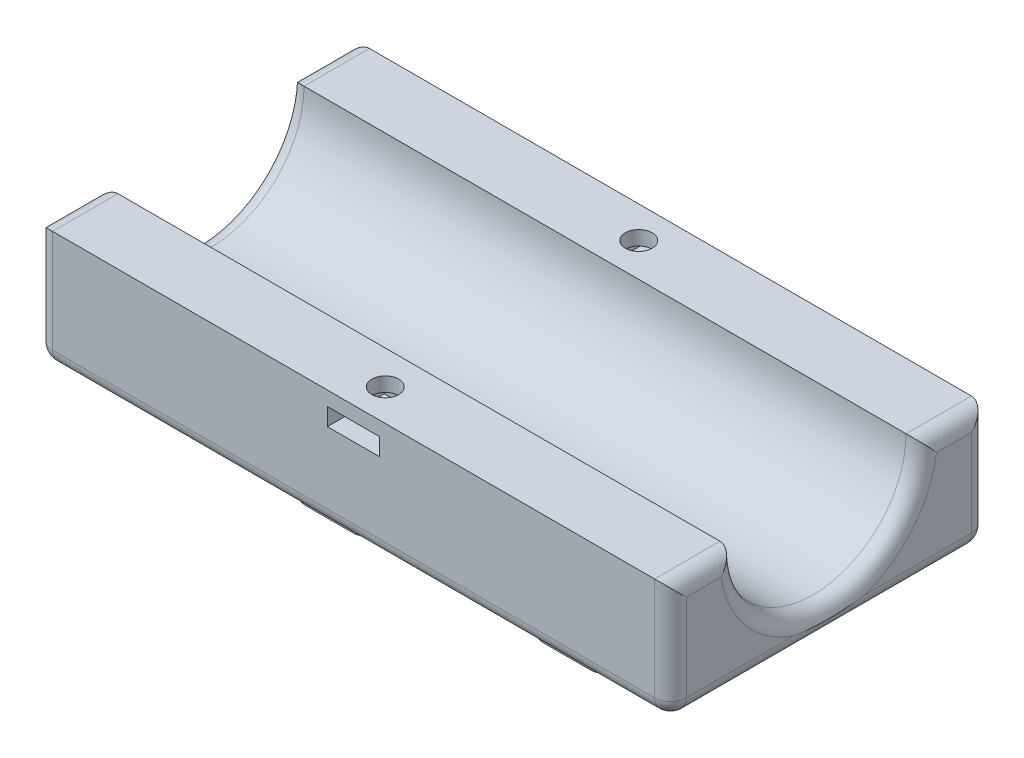
from build123d import *

# Parameters (mm, degrees)
BOSS_EXTRUDE2_DEPTH   = 101.6
SKETCH14_W            = 12.7
SKETCH14_H            = 13.97
BOSS_EXTRUDE3_DEPTH   = 20.32
F_6_CLEARANCE_HOLE1_D = 4.3053
SKETCH8_W             = 8.382
SKETCH8_H             = 9.144
CUT_EXTRUDE2_DEPTH    = 2.794
FILLET1_R             = 2.54


with BuildPart() as part:
    # Sketch3 → Boss-Extrude2 (new body)
    with BuildSketch(Plane(origin=(0, 0, 0), x_dir=(0, 0, -1), z_dir=(1, 0, 0))):
        with BuildLine():
            Line((40.3225, 19.05), (50.8, 19.05))
            Line((50.8, 19.05), (50.8, 0))
            Line((50.8, 0), (0, 0))
            Line((0, 0), (0, 19.05))
            Line((0, 19.05), (10.4775, 19.05))
            ThreePointArc((10.4775, 19.05), (25.4, 4.1275), (40.3225, 19.05))
        make_face()
    extrude(amount=BOSS_EXTRUDE2_DEPTH)

    # Sketch14 → Boss-Extrude3 (add)
    # profile 1 of 2: a face of its own
    with BuildSketch(Plane(origin=(0, 0, -35.56), x_dir=(-1, 0, 0), z_dir=(0, 0, -1))):
        with Locations((-69.85, -6.985)):
            Rectangle(SKETCH14_W, SKETCH14_H)
        with BuildLine():
            Line((-66.675, -5.08), (-66.675, -8.89))
            ThreePointArc((-66.675, -8.89), (-69.85, -12.065), (-73.025, -8.89))
            Line((-73.025, -8.89), (-73.025, -5.08))
            ThreePointArc((-73.025, -5.08), (-69.85, -1.905), (-66.675, -5.08))
        make_face(mode=Mode.SUBTRACT)
    # profile 2 of 2: a face of its own
    with BuildSketch(Plane(origin=(0, 0, -35.56), x_dir=(-1, 0, 0), z_dir=(0, 0, -1))):
        with Locations((-31.75, -6.985)):
            Rectangle(SKETCH14_W, SKETCH14_H)
        with BuildLine():
            Line((-28.575, -5.08), (-28.575, -8.89))
            ThreePointArc((-28.575, -8.89), (-31.75, -12.065), (-34.925, -8.89))
            Line((-34.925, -8.89), (-34.925, -5.08))
            ThreePointArc((-34.925, -5.08), (-31.75, -1.905), (-28.575, -5.08))
        make_face(mode=Mode.SUBTRACT)
    extrude(amount=-BOSS_EXTRUDE3_DEPTH)

    # #6 Clearance Hole1 (through all)
    with Locations(Plane(origin=(0, 19.05, 0), x_dir=(1, 0, 0), z_dir=(0, 1, 0))):
        with Locations((50.8, 5.08), (50.8, 45.72)):
            Hole(F_6_CLEARANCE_HOLE1_D / 2)

    # Sketch8 → Cut-Extrude2 (cut)
    with BuildSketch(Plane(origin=(0, 13.97, 0), x_dir=(1, 0, 0), z_dir=(0, 1, 0))):
        with Locations((50.8, 4.572)):
            Rectangle(SKETCH8_W, SKETCH8_H)
        with Locations((50.8, 46.228)):
            Rectangle(SKETCH8_W, SKETCH8_H)
    extrude(amount=CUT_EXTRUDE2_DEPTH, mode=Mode.SUBTRACT)

    # Fillet1
    # the kernel refuses this fillet: 2.54 mm, written as the material it adds along each edge
    with BuildSketch(Plane(origin=(63.5, 0, -35.56), x_dir=(-1, 0, 0), z_dir=(0, 0, 1)), Plane(origin=(25.4, 0, -35.56), x_dir=(-1, 0, 0), z_dir=(0, 0, 1))) as fillet1_piece_1:
        with BuildLine():
            CenterArc((FILLET1_R, FILLET1_R), FILLET1_R, 180, 90)
            Line((0, FILLET1_R), (0, 0))
            Line((0, 0), (FILLET1_R, 0))
        make_face()
    extrude(amount=20.32)
    with BuildSketch(Plane(origin=(76.2, 0, -35.56), x_dir=(1, 0, 0), z_dir=(0, 0, 1)), Plane(origin=(38.1, 0, -35.56), x_dir=(1, 0, 0), z_dir=(0, 0, 1))) as fillet1_piece_2:
        with BuildLine():
            CenterArc((FILLET1_R, -FILLET1_R), FILLET1_R, 90, 90)
            Line((0, -FILLET1_R), (0, 0))
            Line((0, 0), (FILLET1_R, 0))
        make_face()
    extrude(amount=20.32)
    # the kernel refuses this fillet: 2.54 mm, written as the material it takes off along each edge
    with BuildSketch(Plane(origin=(2.54, 2.54, -48.26), x_dir=(-1, 0, 0), z_dir=(0, 0, -1))) as fillet1_2_piece_1_section:
        Polygon((0, 0), (FILLET1_R, 0), (FILLET1_R, -FILLET1_R), (0, -FILLET1_R), align=None)
    fillet1_2_piece_1 = extrude(amount=FILLET1_R, mode=Mode.PRIVATE)
    fillet1_2_piece_1 = fillet1_2_piece_1 - Plane(origin=(2.54, 2.54, -48.26), x_dir=(0.7071067811865475, 0.7071067811865475, 0), z_dir=(0, 0, -1)) * Sphere(FILLET1_R, mode=Mode.PRIVATE)
    add(fillet1_2_piece_1, mode=Mode.SUBTRACT)
    with BuildSketch(Plane(origin=(99.06, 2.54, -48.26), x_dir=(1, 0, 0), z_dir=(0, 0, -1))) as fillet1_2_piece_2_section:
        Polygon((0, 0), (FILLET1_R, 0), (FILLET1_R, FILLET1_R), (0, FILLET1_R), align=None)
    fillet1_2_piece_2 = extrude(amount=FILLET1_R, mode=Mode.PRIVATE)
    fillet1_2_piece_2 = fillet1_2_piece_2 - Plane(origin=(99.06, 2.54, -48.26), x_dir=(-0.7071067811865475, 0.7071067811865475, 0), z_dir=(0, 0, -1)) * Sphere(FILLET1_R, mode=Mode.PRIVATE)
    add(fillet1_2_piece_2, mode=Mode.SUBTRACT)
    with BuildSketch(Plane(origin=(2.54, 2.54, -2.54), x_dir=(0, 0, 1), z_dir=(-1, 0, 0))) as fillet1_2_piece_3_section:
        Polygon((0, 0), (FILLET1_R, 0), (FILLET1_R, -FILLET1_R), (0, -FILLET1_R), align=None)
    fillet1_2_piece_3 = extrude(amount=FILLET1_R, mode=Mode.PRIVATE)
    fillet1_2_piece_3 = fillet1_2_piece_3 - Plane(origin=(2.54, 2.54, -2.54), x_dir=(0, 0.7071067811865475, -0.7071067811865475), z_dir=(-1, 0, 0)) * Sphere(FILLET1_R, mode=Mode.PRIVATE)
    add(fillet1_2_piece_3, mode=Mode.SUBTRACT)
    with BuildSketch(Plane(origin=(99.06, 2.54, -2.54), x_dir=(0, 0, 1), z_dir=(1, 0, 0))) as fillet1_2_piece_4_section:
        Polygon((0, 0), (FILLET1_R, 0), (FILLET1_R, FILLET1_R), (0, FILLET1_R), align=None)
    fillet1_2_piece_4 = extrude(amount=FILLET1_R, mode=Mode.PRIVATE)
    fillet1_2_piece_4 = fillet1_2_piece_4 - Plane(origin=(99.06, 2.54, -2.54), x_dir=(0, 0.7071067811865475, -0.7071067811865475), z_dir=(1, 0, 0)) * Sphere(FILLET1_R, mode=Mode.PRIVATE)
    add(fillet1_2_piece_4, mode=Mode.SUBTRACT)
    with BuildSketch(Plane(origin=(2.54, 0, -50.8), x_dir=(0, 0, 1), z_dir=(1, 0, 0))) as fillet1_2_piece_5:
        with BuildLine():
            CenterArc((FILLET1_R, -FILLET1_R), FILLET1_R, 90, 90)
            Line((0, -FILLET1_R), (0, 0))
            Line((0, 0), (FILLET1_R, 0))
        make_face()
    extrude(amount=96.52, mode=Mode.SUBTRACT)
    with BuildSketch(Plane(origin=(2.54, 0, 0), x_dir=(0, 0, -1), z_dir=(1, 0, 0))) as fillet1_2_piece_6:
        with BuildLine():
            CenterArc((FILLET1_R, FILLET1_R), FILLET1_R, 180, 90)
            Line((0, FILLET1_R), (0, 0))
            Line((0, 0), (FILLET1_R, 0))
        make_face()
    extrude(amount=96.52, mode=Mode.SUBTRACT)
    with BuildSketch(Plane(origin=(101.6, 25.4, -50.8), x_dir=(-1, 0, 0), z_dir=(0, -1, 0)), Plane(origin=(101.6, 2.54, 0), x_dir=(-1, 0, 0), z_dir=(0, 1, 0))) as fillet1_2_piece_7:
        with BuildLine():
            CenterArc((FILLET1_R, -FILLET1_R), FILLET1_R, 90, 90)
            Line((0, -FILLET1_R), (0, 0))
            Line((0, 0), (FILLET1_R, 0))
        make_face()
    extrude(amount=22.86, mode=Mode.SUBTRACT)
    with BuildSketch(Plane(origin=(101.6, 19.05, -33.9725), x_dir=(-1, 0, 0), z_dir=(0, 0, -1)), Plane(origin=(101.6, 19.05, 6.35), x_dir=(-1, 0, 0), z_dir=(0, 0, -1))) as fillet1_2_piece_8:
        with BuildLine():
            CenterArc((FILLET1_R, -FILLET1_R), FILLET1_R, 90, 90)
            Line((0, -FILLET1_R), (0, 0))
            Line((0, 0), (FILLET1_R, 0))
        make_face()
    extrude(amount=23.1775, mode=Mode.SUBTRACT)
    with BuildSketch(Plane(origin=(101.6, 19.05, -25.4), x_dir=(0, 0.4134285279773088, 0.9105365738148663), z_dir=(0, 0.9105365738148663, -0.4134285279773088))) as fillet1_2_piece_9:
        with BuildLine():
            CenterArc((14.9225 + FILLET1_R, -FILLET1_R), FILLET1_R, 90, 90)
            Line((14.9225, -FILLET1_R), (14.9225, 0))
            Line((14.9225, 0), (14.9225 + FILLET1_R, 0))
        make_face()
    revolve(axis=Axis((101.6, 19.05, -25.4), (1, 0, 0)), revolution_arc=228.840784647, mode=Mode.SUBTRACT)
    with BuildSketch(Plane(origin=(63.5, -13.97, -41.91), x_dir=(1, 0, 0), z_dir=(0, 0, 1)), Plane(origin=(76.2, -13.97, -41.91), x_dir=(0, 1, 0), z_dir=(0, 0, 1)), Plane(origin=(25.4, -13.97, -41.91), x_dir=(1, 0, 0), z_dir=(0, 0, 1)), Plane(origin=(38.1, -13.97, -41.91), x_dir=(0, 1, 0), z_dir=(0, 0, 1))) as fillet1_2_piece_10:
        with BuildLine():
            CenterArc((FILLET1_R, FILLET1_R), FILLET1_R, 180, 90)
            Line((0, FILLET1_R), (0, 0))
            Line((0, 0), (FILLET1_R, 0))
        make_face()
    extrude(amount=33.02, mode=Mode.SUBTRACT)
    with BuildSketch(Plane(origin=(0, 19.05, 6.35), x_dir=(1, 0, 0), z_dir=(0, 0, -1)), Plane(origin=(0, 19.05, -33.9725), x_dir=(1, 0, 0), z_dir=(0, 0, -1))) as fillet1_2_piece_11:
        with BuildLine():
            CenterArc((FILLET1_R, FILLET1_R), FILLET1_R, 180, 90)
            Line((0, FILLET1_R), (0, 0))
            Line((0, 0), (FILLET1_R, 0))
        make_face()
    extrude(amount=23.1775, mode=Mode.SUBTRACT)
    with BuildSketch(Plane(origin=(0, 19.05, -25.4), x_dir=(0, 0.4134285279773076, 0.9105365738148669), z_dir=(0, 0.9105365738148669, -0.4134285279773076))) as fillet1_2_piece_12:
        with BuildLine():
            CenterArc((14.9225 + FILLET1_R, FILLET1_R), FILLET1_R, 180, 90)
            Line((14.9225, FILLET1_R), (14.9225, 0))
            Line((14.9225, 0), (14.9225 + FILLET1_R, 0))
        make_face()
    revolve(axis=Axis((0, 19.05, -25.4), (1, 0, 0)), revolution_arc=228.840784647, mode=Mode.SUBTRACT)
    with BuildSketch(Plane(origin=(0, 25.4, -50.8), x_dir=(1, 0, 0), z_dir=(0, -1, 0)), Plane(origin=(0, 2.54, 0), x_dir=(1, 0, 0), z_dir=(0, 1, 0))) as fillet1_2_piece_13:
        with BuildLine():
            CenterArc((FILLET1_R, FILLET1_R), FILLET1_R, 180, 90)
            Line((0, FILLET1_R), (0, 0))
            Line((0, 0), (FILLET1_R, 0))
        make_face()
    extrude(amount=22.86, mode=Mode.SUBTRACT)
    with BuildSketch(Plane(origin=(0, 0, -48.26), x_dir=(1, 0, 0), z_dir=(0, 0, 1))) as fillet1_2_piece_14:
        with BuildLine():
            CenterArc((FILLET1_R, FILLET1_R), FILLET1_R, 180, 90)
            Line((0, FILLET1_R), (0, 0))
            Line((0, 0), (FILLET1_R, 0))
        make_face()
    extrude(amount=45.72, mode=Mode.SUBTRACT)
    with BuildSketch(Plane(origin=(101.6, 0, -48.26), x_dir=(-1, 0, 0), z_dir=(0, 0, 1))) as fillet1_2_piece_15:
        with BuildLine():
            CenterArc((FILLET1_R, -FILLET1_R), FILLET1_R, 90, 90)
            Line((0, -FILLET1_R), (0, 0))
            Line((0, 0), (FILLET1_R, 0))
        make_face()
    extrude(amount=45.72, mode=Mode.SUBTRACT)


solid = part.part
